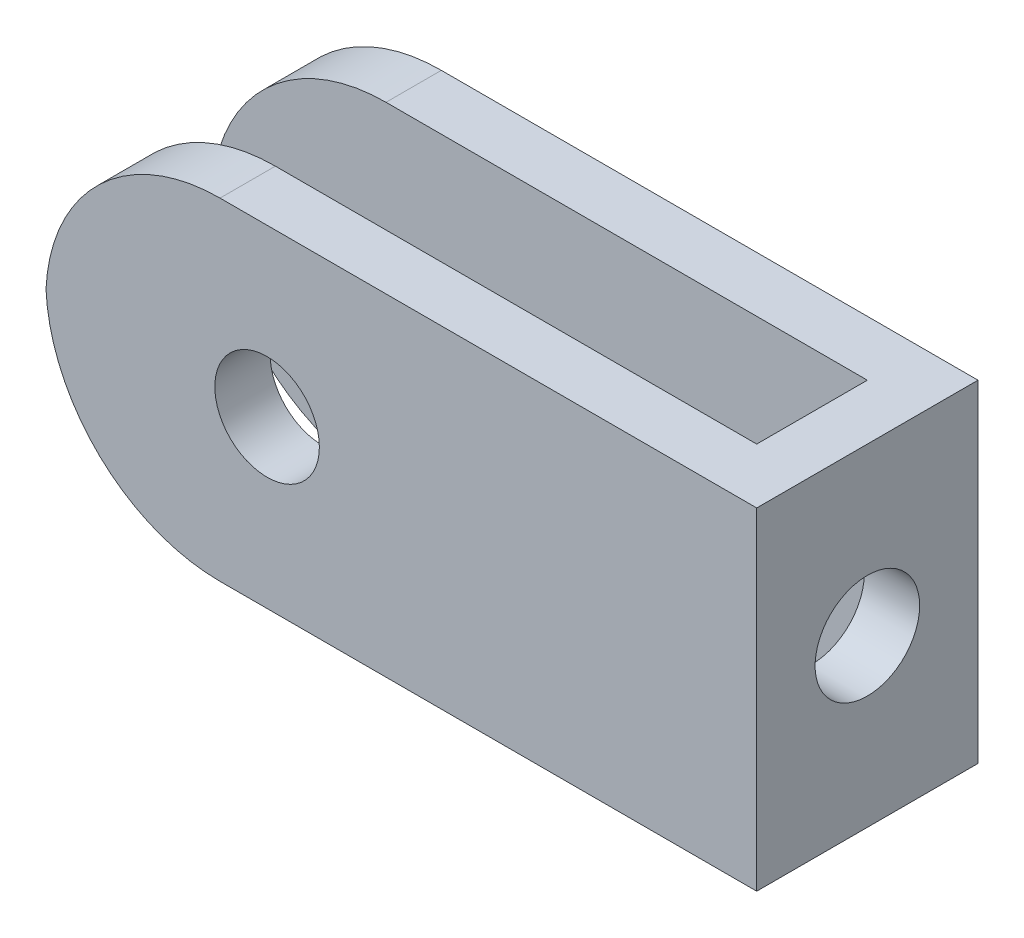
from build123d import *

# Parameters (mm, degrees)
BOSS_EXTRUDE1_DEPTH = 19.05
SKETCH2_R           = 3
CUT_EXTRUDE1_DEPTH  = 3.175
CUT_EXTRUDE2_REACH  = 48.785
SKETCH3_R           = 3
FILLET1_R           = 10


with BuildPart() as part:
    # Sketch1 → Boss-Extrude1 (new body)
    with BuildSketch(Plane(origin=(0, 0, 0), x_dir=(1, 0, 0), z_dir=(0, 1, 0))):
        Polygon((0, 0), (37.625, 0), (37.625, -6.35), (0, -6.35), (0, -9.525), (40.8, -9.525), (40.8, 3.175), (0, 3.175), align=None)
    extrude(amount=BOSS_EXTRUDE1_DEPTH)

    # Sketch2 → Cut-Extrude1 (cut)
    with BuildSketch(Plane(origin=(40.8, 0, 0), x_dir=(0, 0, -1), z_dir=(1, 0, 0))):
        with Locations((-3.175, 9.525)):
            Circle(SKETCH2_R)
    extrude(amount=-CUT_EXTRUDE1_DEPTH, mode=Mode.SUBTRACT)

    # Cut-Extrude2: up to this face of the body (flat: up to its plane)
    cut_extrude2_end = Plane(part.part.faces().sort_by_distance((20.4, 9.525, -3.175))[0])
    # Sketch3 → Cut-Extrude2 (cut, up to the picked face)
    with BuildSketch(Plane.XY.offset(9.525), mode=Mode.PRIVATE) as cut_extrude2_sk1:
        with Locations((12.7, 9.525)):
            Circle(SKETCH3_R)
    cut_extrude2_tool1 = split(extrude(cut_extrude2_sk1.sketch, amount=-CUT_EXTRUDE2_REACH, mode=Mode.PRIVATE), bisect_by=cut_extrude2_end, keep=Keep.BOTH, mode=Mode.PRIVATE)
    add(cut_extrude2_tool1.solids().sort_by(Axis((12.7, 9.525, 9.525), (0, 0, -1)))[0], mode=Mode.SUBTRACT)

    # Fillet1
    # the kernel refuses this fillet: 10 mm, written as the material it takes off along each edge
    with BuildSketch(Plane(origin=(0, 0, -28.175), x_dir=(0, 1, 0), z_dir=(0, 0, 1)), Plane(origin=(0, 19.05, -18.65), x_dir=(1, 0, 0), z_dir=(0, 0, 1))) as fillet1_piece_1:
        with BuildLine():
            CenterArc((FILLET1_R, -FILLET1_R), FILLET1_R, 90, 90)
            Line((0, -FILLET1_R), (0, 0))
            Line((0, 0), (FILLET1_R, 0))
        make_face()
    extrude(amount=53.175, mode=Mode.SUBTRACT)
    with BuildSketch(Plane(origin=(0, 19.05, -28.175), x_dir=(0, -1, 0), z_dir=(0, 0, 1)), Plane(origin=(0, 0, -18.65), x_dir=(1, 0, 0), z_dir=(0, 0, 1))) as fillet1_piece_2:
        with BuildLine():
            CenterArc((FILLET1_R, FILLET1_R), FILLET1_R, 180, 90)
            Line((0, FILLET1_R), (0, 0))
            Line((0, 0), (FILLET1_R, 0))
        make_face()
    extrude(amount=53.175, mode=Mode.SUBTRACT)


solid = part.part
